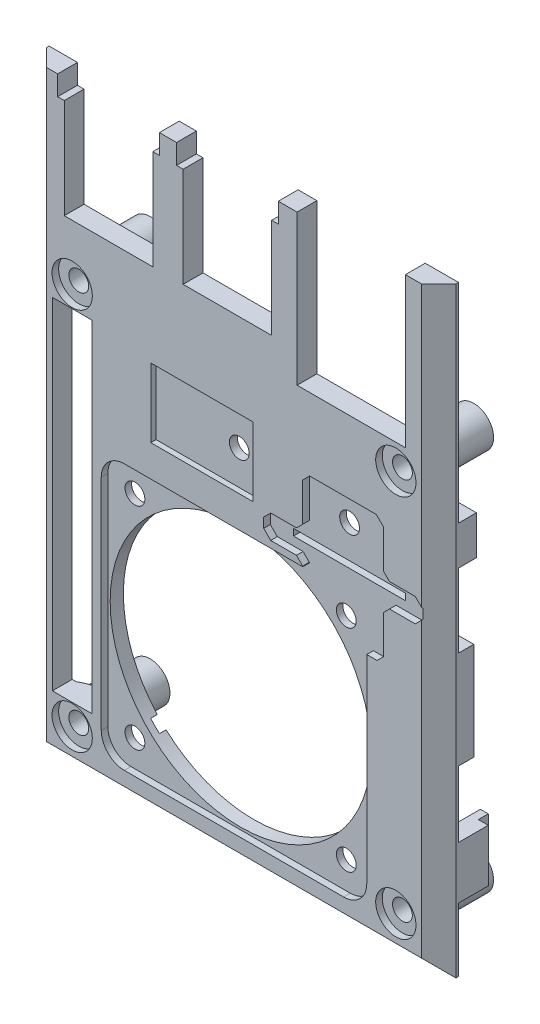
from build123d import *
from build123d.topology import SkipClean

# Parameters (mm, degrees)
SKETCH1_R                       = 1.5
SKETCH1_W                       = 17
SKETCH1_H                       = 1
SKETCH1_W_2                     = 6
SKETCH1_H_2                     = 51.6
BOSS_EXTRUDE1_DEPTH             = 3
CHAMFER4_SIZE                   = 2.6
BOSS_EXTRUDE2_START             = 8.8
SKETCH3_R                       = 3
SKETCH3_R_2                     = 1.5
BOSS_EXTRUDE2_DEPTH             = 8.8
SKETCH4_R                       = 3.05
CUT_EXTRUDE1_DEPTH              = 1
CHAMFER1_SIZE                   = 1
CUT_EXTRUDE2_DEPTH              = 0.4
SKETCH5_W                       = 2.7
SKETCH5_H                       = 5.9
BOSS_EXTRUDE3_DEPTH             = 2.7
SKETCH6_W                       = 2.7
SKETCH6_H                       = 14.8
BOSS_EXTRUDE4_DEPTH             = 2.3
SKETCH8_W                       = 2.7
SKETCH8_H                       = 7.95
BOSS_EXTRUDE5_DEPTH             = 6
SKETCH10_W                      = 1.5
SKETCH10_H                      = 7.95
CUT_EXTRUDE4_DEPTH              = 1.5
CUT_EXTRUDE8_REACH              = 58.307
SKETCH15_R                      = 1.5
SKETCH15_R_2                    = 19.75
CUT_EXTRUDE9_DEPTH              = 1
CUT_EXTRUDE11_REACH             = 58.307
SKETCH18_R                      = 1.5
CUT_EXTRUDE12_DEPTH             = 1
CUT_EXTRUDE13_REACH             = 58.307
SKETCH20_R                      = 1.5
CUT_EXTRUDE13_DIRECTION_2_DEPTH = 57.307104347
SKETCH21_W                      = 15.5
SKETCH21_H                      = 10.45
CUT_EXTRUDE14_DEPTH             = 0.8
SKETCH17_R                      = 3.05
CUT_EXTRUDE10_DEPTH             = 1


with BuildPart() as part:
    # Sketch1 → Boss-Extrude1 (new body)
    with BuildSketch(Plane.XY):
        Polygon((-31, 45.5), (-26.7, 45.5), (-26.7, 42.5), (-25.7, 42.5), (-25.7, 27.4), (-12.3, 27.4), (-12.3, 42.5), (-11.3, 42.5), (-11.3, 45.5), (-8.7, 45.5), (-8.7, 42.5), (-7.7, 42.5), (-7.7, 27.4), (5.7, 27.4), (5.7, 42.5), (6.7, 42.5), (6.7, 45.5), (9.55, 45.5), (9.55, 22.8), (25.95, 22.8), (25.95, 45.5), (31, 45.5), (31, -45.5), (-31, -45.5), align=None)
        with Locations((24.5, -39)):
            Circle(SKETCH1_R, mode=Mode.SUBTRACT)
        with Locations((-24.5, -39)):
            Circle(SKETCH1_R, mode=Mode.SUBTRACT)
        with Locations((-24.5, 19)):
            Circle(SKETCH1_R, mode=Mode.SUBTRACT)
        with Locations((24.5, 19)):
            Circle(SKETCH1_R, mode=Mode.SUBTRACT)
        with Locations((16.5, 2.25)):
            Rectangle(SKETCH1_W, SKETCH1_H, mode=Mode.SUBTRACT)
        with Locations((-24.5, -10)):
            Rectangle(SKETCH1_W_2, SKETCH1_H_2, mode=Mode.SUBTRACT)
    extrude(amount=BOSS_EXTRUDE1_DEPTH)

    # Chamfer4
    chamfer4_edges = [part.edges().sort_by_distance(p)[0] for p in [
        (31, 0, 3),
        (-31, 0, 3),
        (0, -45.5, 3),
    ]]
    chamfer(chamfer4_edges, length=CHAMFER4_SIZE)

    # Sketch3 → Boss-Extrude2 (add)
    # profile 1 of 4: a face of its own
    with SkipClean():  # the faces are left unmerged after this step: merging them gives an invalid solid
        with BuildSketch(Plane(origin=(0, 0, 0), x_dir=(-1, 0, 0), z_dir=(0, 0, -1)).offset(BOSS_EXTRUDE2_START)):
            with Locations(Location((-24.5, 19, 0), (0, 0, 180))):
                Circle(SKETCH3_R)
            with Locations((-24.5, 19)):
                Circle(SKETCH3_R_2, mode=Mode.SUBTRACT)
        # profile 2 of 4: a face of its own
        with BuildSketch(Plane(origin=(0, 0, 0), x_dir=(-1, 0, 0), z_dir=(0, 0, -1)).offset(BOSS_EXTRUDE2_START)):
            with Locations(Location((24.5, 19, 0), (0, 0, 180))):
                Circle(SKETCH3_R)
            with Locations((24.5, 19)):
                Circle(SKETCH3_R_2, mode=Mode.SUBTRACT)
        # profile 3 of 4: a face of its own
        with BuildSketch(Plane(origin=(0, 0, 0), x_dir=(-1, 0, 0), z_dir=(0, 0, -1)).offset(BOSS_EXTRUDE2_START)):
            with Locations(Location((24.5, -39, 0), (0, 0, 180))):
                Circle(SKETCH3_R)
            with Locations((24.5, -39)):
                Circle(SKETCH3_R_2, mode=Mode.SUBTRACT)
        # profile 4 of 4: a face of its own
        with BuildSketch(Plane(origin=(0, 0, 0), x_dir=(-1, 0, 0), z_dir=(0, 0, -1)).offset(BOSS_EXTRUDE2_START)):
            with Locations(Location((-24.5, -39, 0), (0, 0, 180))):
                Circle(SKETCH3_R)
            with Locations((-24.5, -39)):
                Circle(SKETCH3_R_2, mode=Mode.SUBTRACT)
        extrude(amount=-BOSS_EXTRUDE2_DEPTH)

    # Sketch4 → Cut-Extrude1 (cut)
    with BuildSketch(Plane.XY.offset(3)):
        with Locations((-24.5, 19)):
            Circle(SKETCH4_R)
        with Locations((24.5, 19)):
            Circle(SKETCH4_R)
        with Locations((24.5, -39)):
            Circle(SKETCH4_R)
        with Locations((-24.5, -39)):
            Circle(SKETCH4_R)
    extrude(amount=-CUT_EXTRUDE1_DEPTH, mode=Mode.SUBTRACT)

    # Chamfer1
    # the kernel refuses this chamfer: 1 mm, written as the material it adds along each edge
    with BuildSketch(Plane(origin=(24.5, 19, 0), x_dir=(1, 0, 0), z_dir=(0, 1, 0))) as chamfer1_piece_1_section:
        Polygon((3 + CHAMFER1_SIZE, 0), (3, CHAMFER1_SIZE), (3, 0), align=None)
    chamfer1_piece_1 = revolve(axis=Axis((24.5, 19, 0), (0, 0, -1)), mode=Mode.PRIVATE)
    chamfer1_piece_1 = split(chamfer1_piece_1, bisect_by=Plane(origin=(21.015946355, 22.8, -0.484053645), z_dir=(0, -1, 0)), keep=Keep.TOP, mode=Mode.PRIVATE)
    add(chamfer1_piece_1)
    with BuildSketch(Plane(origin=(-24.5, 19, 0), x_dir=(1, 0, 0), z_dir=(0, 1, 0))) as chamfer1_piece_2_section:
        Polygon((3 + CHAMFER1_SIZE, 0), (3, CHAMFER1_SIZE), (3, 0), align=None)
    chamfer1_piece_2 = revolve(axis=Axis((-24.5, 19, 0), (0, 0, -1)), mode=Mode.PRIVATE)
    chamfer1_piece_2 = split(chamfer1_piece_2, bisect_by=Plane(origin=(-27.984460839, 15.8, -0.484460839), z_dir=(0, 1, 0)), keep=Keep.TOP, mode=Mode.PRIVATE)
    add(chamfer1_piece_2)
    with BuildSketch(Plane(origin=(-24.5, -39, 0), x_dir=(1, 0, 0), z_dir=(0, 1, 0))) as chamfer1_piece_3_section:
        Polygon((3 + CHAMFER1_SIZE, 0), (3, CHAMFER1_SIZE), (3, 0), align=None)
    chamfer1_piece_3 = revolve(axis=Axis((-24.5, -39, 0), (0, 0, -1)), mode=Mode.PRIVATE)
    chamfer1_piece_3 = split(chamfer1_piece_3, bisect_by=Plane(origin=(-27.984460832, -35.8, -0.484460832), z_dir=(0, -1, 0)), keep=Keep.TOP, mode=Mode.PRIVATE)
    add(chamfer1_piece_3)
    with BuildSketch(Plane(origin=(24.5, -39, 0), x_dir=(1, 0, 0), z_dir=(0, 1, 0))) as chamfer1_piece_4:
        Polygon((3 + CHAMFER1_SIZE, 0), (3, CHAMFER1_SIZE), (3, 0), align=None)
    revolve(axis=Axis((24.5, -39, 0), (0, 0, -1)))

    # Sketch7 → Cut-Extrude2 (cut)
    with BuildSketch(Plane(origin=(0, 0, 0), x_dir=(-1, 0, 0), z_dir=(0, 0, -1))):
        Polygon((-28.1, 45.5), (-31, 45.5), (-31, -45.5), (31, -45.5), (31, 45.5), (28.1, 45.5), (28.1, -42.6), (-28.1, -42.6), align=None)
    extrude(amount=CUT_EXTRUDE2_DEPTH, mode=Mode.SUBTRACT)

    # Sketch5 → Boss-Extrude3 (add)
    with BuildSketch(Plane(origin=(0, 0, 0), x_dir=(-1, 0, 0), z_dir=(0, 0, -1))):
        with Locations((-29.65, 11)):
            Rectangle(SKETCH5_W, SKETCH5_H)
    extrude(amount=BOSS_EXTRUDE3_DEPTH)

    # Sketch6 → Boss-Extrude4 (add)
    with BuildSketch(Plane(origin=(0, 0, 0), x_dir=(-1, 0, 0), z_dir=(0, 0, -1))):
        with Locations((-29.65, -10.5)):
            Rectangle(SKETCH6_W, SKETCH6_H)
    extrude(amount=BOSS_EXTRUDE4_DEPTH)

    # Sketch8 → Boss-Extrude5 (add)
    with BuildSketch(Plane(origin=(0, 0, 0), x_dir=(-1, 0, 0), z_dir=(0, 0, -1))):
        with Locations((-29.65, -31.9)):
            Rectangle(SKETCH8_W, SKETCH8_H)
    extrude(amount=BOSS_EXTRUDE5_DEPTH)

    # Sketch10 → Cut-Extrude4 (cut)
    with BuildSketch(Plane(origin=(31, 0, 0), x_dir=(0, 0, -1), z_dir=(1, 0, 0))):
        with Locations((5.25, -31.9)):
            Rectangle(SKETCH10_W, SKETCH10_H)
    extrude(amount=-CUT_EXTRUDE4_DEPTH, mode=Mode.SUBTRACT)

    # Sketch15 → Cut-Extrude8 (cut, up to next)
    with BuildSketch(Plane.XY.offset(3), mode=Mode.PRIVATE) as cut_extrude8_sk1:
        with Locations((-16, -4.679605933)):
            Circle(SKETCH15_R)
    cut_extrude8_tool1 = extrude(cut_extrude8_sk1.sketch, amount=-CUT_EXTRUDE8_REACH, mode=Mode.PRIVATE) & part.part
    # Sketch15 → Cut-Extrude8 (cut, up to next)
    with BuildSketch(Plane.XY.offset(3), mode=Mode.PRIVATE) as cut_extrude8_sk2:
        with Locations((16, -4.679605933)):
            Circle(SKETCH15_R)
    cut_extrude8_tool2 = extrude(cut_extrude8_sk2.sketch, amount=-CUT_EXTRUDE8_REACH, mode=Mode.PRIVATE) & part.part
    # Sketch15 → Cut-Extrude8 (cut, up to next)
    with BuildSketch(Plane.XY.offset(3), mode=Mode.PRIVATE) as cut_extrude8_sk3:
        with Locations((16, -36.679605933)):
            Circle(SKETCH15_R)
    cut_extrude8_tool3 = extrude(cut_extrude8_sk3.sketch, amount=-CUT_EXTRUDE8_REACH, mode=Mode.PRIVATE) & part.part
    # Sketch15 → Cut-Extrude8 (cut, up to next)
    with BuildSketch(Plane.XY.offset(3), mode=Mode.PRIVATE) as cut_extrude8_sk4:
        with Locations((-16, -36.679605933)):
            Circle(SKETCH15_R)
    cut_extrude8_tool4 = extrude(cut_extrude8_sk4.sketch, amount=-CUT_EXTRUDE8_REACH, mode=Mode.PRIVATE) & part.part
    # Sketch15 → Cut-Extrude8 (cut, up to next)
    with BuildSketch(Plane.XY.offset(3), mode=Mode.PRIVATE) as cut_extrude8_sk5:
        with Locations((0, -20.679605933)):
            Circle(SKETCH15_R_2)
    cut_extrude8_tool5 = extrude(cut_extrude8_sk5.sketch, amount=-CUT_EXTRUDE8_REACH, mode=Mode.PRIVATE) & part.part
    add(cut_extrude8_tool1.solids().sort_by_distance((-16, -4.679606, 3))[0], mode=Mode.SUBTRACT)
    add(cut_extrude8_tool2.solids().sort_by_distance((16, -4.679606, 3))[0], mode=Mode.SUBTRACT)
    add(cut_extrude8_tool3.solids().sort_by_distance((16, -36.679606, 3))[0], mode=Mode.SUBTRACT)
    add(cut_extrude8_tool4.solids().sort_by_distance((-16, -36.679606, 3))[0], mode=Mode.SUBTRACT)
    add(cut_extrude8_tool5.solids().sort_by_distance((0, -20.679606, 3))[0], mode=Mode.SUBTRACT)

    # Sketch16 → Cut-Extrude9 (cut)
    with BuildSketch(Plane.XY.offset(3)):
        with BuildLine():
            Line((-16.6, -0.579605933), (16.6, -0.579605933))
            ThreePointArc((16.6, -0.579605933), (19.074873734, -1.604732199), (20.1, -4.079605933))
            Line((20.1, -4.079605933), (20.1, -37.279605933))
            ThreePointArc((20.1, -37.279605933), (19.074873734, -39.754479668), (16.6, -40.779605933))
            Line((16.6, -40.779605933), (-16.6, -40.779605933))
            ThreePointArc((-16.6, -40.779605933), (-19.074873734, -39.754479668), (-20.1, -37.279605933))
            Line((-20.1, -37.279605933), (-20.1, -4.079605933))
            ThreePointArc((-20.1, -4.079605933), (-19.074873734, -1.604732199), (-16.6, -0.579605933))
        make_face()
    extrude(amount=-CUT_EXTRUDE9_DEPTH, mode=Mode.SUBTRACT)

    # Sketch18 → Cut-Extrude11 (cut, up to next)
    with BuildSketch(Plane.XY.offset(3), mode=Mode.PRIVATE) as cut_extrude11_sk1:
        with Locations((16.5, 7.75)):
            Circle(SKETCH18_R)
    cut_extrude11_tool1 = extrude(cut_extrude11_sk1.sketch, amount=-CUT_EXTRUDE11_REACH, mode=Mode.PRIVATE) & part.part
    add(cut_extrude11_tool1.solids().sort_by_distance((16.5, 7.75, 3))[0], mode=Mode.SUBTRACT)

    # Sketch19 → Cut-Extrude12 (cut)
    with BuildSketch(Plane.XY.offset(3)):
        with BuildLine():
            Line((22.6, -6.291421356), (21.658578644, -7.232842712))
            Line((21.658578644, -7.232842712), (20.1, -7.232842712))
            Line((20.1, -7.232842712), (20.1, -4.079605933))
            ThreePointArc((20.1, -4.079605933), (19.074873734, -1.604732199), (16.6, -0.579605933))
            Line((16.6, -0.579605933), (10.4, -0.579605933))
            Line((10.4, -0.579605933), (10.4, -0.491421356))
            Line((10.4, -0.491421356), (9.458578644, 0.45))
            Line((9.458578644, 0.45), (5.558578644, 0.45))
            Line((5.558578644, 0.45), (4.5, 1.508578644))
            Line((4.5, 1.508578644), (4.5, 2.991421356))
            Line((4.5, 2.991421356), (5.558578644, 4.05))
            Line((5.558578644, 4.05), (9.458578644, 4.05))
            Line((9.458578644, 4.05), (10.4, 4.991421356))
            Line((10.4, 4.991421356), (10.4, 10.791421356))
            Line((10.4, 10.791421356), (11.458578644, 11.85))
            Line((11.458578644, 11.85), (21.541421356, 11.85))
            Line((21.541421356, 11.85), (22.6, 10.791421356))
            Line((22.6, 10.791421356), (22.6, 4.991421356))
            Line((22.6, 4.991421356), (23.541421356, 4.05))
            Line((23.541421356, 4.05), (27.441421356, 4.05))
            Line((27.441421356, 4.05), (28.5, 2.991421356))
            Line((28.5, 2.991421356), (28.5, 1.508578644))
            Line((28.5, 1.508578644), (27.441421356, 0.45))
            Line((27.441421356, 0.45), (23.541421356, 0.45))
            Line((23.541421356, 0.45), (22.6, -0.491421356))
            Line((22.6, -0.491421356), (22.6, -6.291421356))
        make_face()
    extrude(amount=-CUT_EXTRUDE12_DEPTH, mode=Mode.SUBTRACT)

    # Sketch20 → Cut-Extrude13 (cut, up to next)
    with BuildSketch(Plane.XY.offset(3), mode=Mode.PRIVATE) as cut_extrude13_sk1:
        with Locations(Location((0, 9.420394067, 0), (0, 0, 180))):
            Circle(SKETCH20_R)
    cut_extrude13_tool1 = extrude(cut_extrude13_sk1.sketch, amount=-CUT_EXTRUDE13_REACH, mode=Mode.PRIVATE) & part.part
    add(cut_extrude13_tool1.solids().sort_by_distance((0, 9.420394, 3))[0], mode=Mode.SUBTRACT)

    # Sketch20 → Cut-Extrude13 direction 2 (cut)
    with BuildSketch(Plane.XY.offset(3)):
        with Locations(Location((0, 9.420394067, 0), (0, 0, 180))):
            Circle(SKETCH20_R)
    extrude(amount=CUT_EXTRUDE13_DIRECTION_2_DEPTH, mode=Mode.SUBTRACT)

    # Sketch21 → Cut-Extrude14 (cut)
    with BuildSketch(Plane.XY.offset(3)):
        with Locations((-4.85, 9.420394067)):
            Rectangle(SKETCH21_W, SKETCH21_H)
    extrude(amount=-CUT_EXTRUDE14_DEPTH, mode=Mode.SUBTRACT)

    # Sketch17 → Cut-Extrude10 (cut)
    with BuildSketch(Plane(origin=(0, 0, 0), x_dir=(-1, 0, 0), z_dir=(0, 0, -1))):
        with Locations((-16.5, 7.75)):
            Circle(SKETCH17_R)
        with Locations((-16, -4.679605933)):
            Circle(SKETCH17_R)
        with Locations((16, -4.679605933)):
            Circle(SKETCH17_R)
        with Locations((16, -36.679605933)):
            Circle(SKETCH17_R)
        with Locations((-16, -36.679605933)):
            Circle(SKETCH17_R)
        with Locations((0, 9.420394067)):
            Circle(SKETCH17_R)
    extrude(amount=-CUT_EXTRUDE10_DEPTH, mode=Mode.SUBTRACT)


solid = part.part
